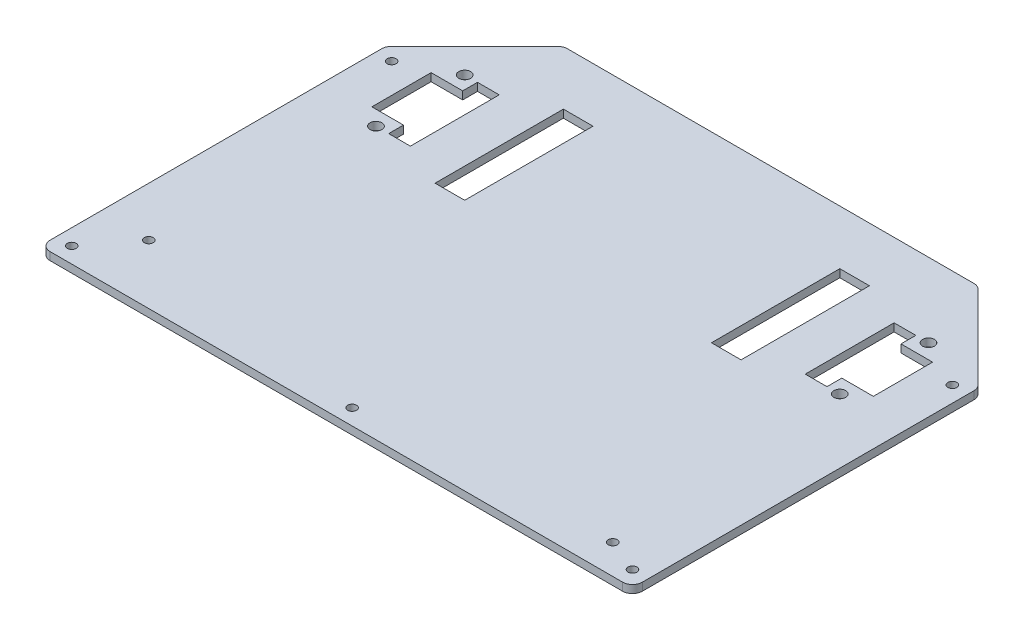
from build123d import *

# Parameters (mm, degrees)
MAIN_EXTRUSION_DEPTH    = 4
CORNER_LEAVE_R          = 5
ESQUISSE2_R             = 3
ESQUISSE2_W             = 15
ESQUISSE2_H             = 65
ENL_V_MAT_EXTRU_1_DEPTH = 267.30058205
D_GAGEMENT_M41_D        = 4.5
D_GAGEMENT_M42_D        = 4.5


with BuildPart() as part:
    # Main scetch → Main extrusion (new body)
    with BuildSketch(Plane(origin=(0, 0, 0), x_dir=(1, 0, 0), z_dir=(0, 1, 0))):
        Polygon((-150, 0), (150, 0), (150, 175), (105, 220), (-105, 220), (-150, 175), align=None)
    extrude(amount=MAIN_EXTRUSION_DEPTH)

    # Corner leave
    corner_leave_edges = [part.edges().sort_by_distance(p)[0] for p in [
        (-150, 2, 0),
        (150, 2, -175),
        (105, 2, -220),
        (150, 2, 0),
        (-105, 2, -220),
        (-150, 2, -175),
    ]]
    fillet(corner_leave_edges, radius=CORNER_LEAVE_R)

    # Esquisse2 → Enlèv. mat.-Extru.1 (cut, through all)
    with BuildSketch(Plane(origin=(0, 4, 0), x_dir=(1, 0, 0), z_dir=(0, 1, 0))):
        with Locations((117.47, 182.47)):
            Circle(ESQUISSE2_R)
        with Locations((117.47, 137.53)):
            Circle(ESQUISSE2_R)
        with Locations((-117.47, 137.53)):
            Circle(ESQUISSE2_R)
        with Locations((-117.47, 182.47)):
            Circle(ESQUISSE2_R)
        with Locations((70, 160)):
            Rectangle(ESQUISSE2_W, ESQUISSE2_H)
        Polygon((100, 137.5), (100, 182.5), (111, 182.5), (111, 175), (127, 175), (127, 145), (111, 145), (111, 137.5), align=None)
        Polygon((-111, 137.5), (-111, 145), (-127, 145), (-127, 175), (-111, 175), (-111, 182.5), (-100, 182.5), (-100, 137.5), align=None)
        with Locations((-70, 160)):
            Rectangle(ESQUISSE2_W, ESQUISSE2_H)
    extrude(amount=-ENL_V_MAT_EXTRU_1_DEPTH, mode=Mode.SUBTRACT)

    # Dégagement M41 (through all)
    with Locations(Plane(origin=(0, 4, 0), x_dir=(1, 0, 0), z_dir=(0, 1, 0))):
        with Locations((-125, 30), (125, 15)):
            Hole(D_GAGEMENT_M41_D / 2)

    # Dégagement M42 (through all)
    with Locations(Plane(origin=(0, 4, 0), x_dir=(1, 0, 0), z_dir=(0, 1, 0))):
        with Locations((-142, 8), (0, 8), (142, 8), (142, 170), (-142, 170)):
            Hole(D_GAGEMENT_M42_D / 2)


solid = part.part
